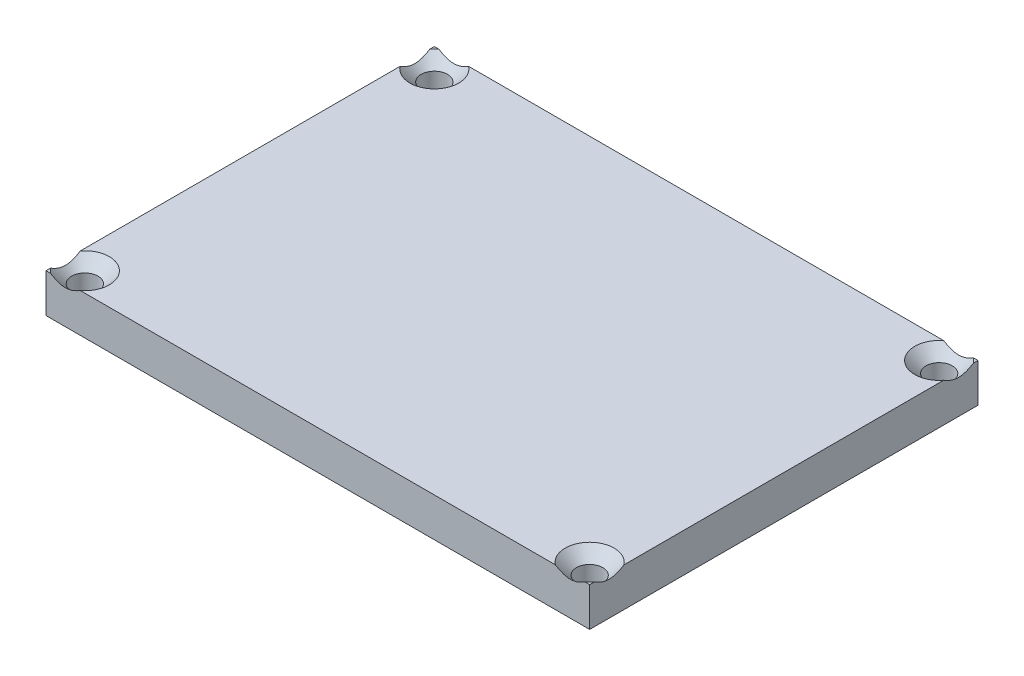
from build123d import *

# Parameters (mm, degrees)
CROQUIS1_W              = 70
CROQUIS1_H              = 50
SALIENTE_EXTRUIR1_DEPTH = 5


# Read off the part's stored shape, not the designer's step: Avellanado para tornillo con cabeza plana avellanada de M31
with BuildPart() as part:
    # Croquis1 → Saliente-Extruir1 (new body)
    with BuildSketch(Plane(origin=(0, 0, 0), x_dir=(1, 0, 0), z_dir=(0, 1, 0))):
        with Locations((-2.583892617, -6.286353468)):
            Rectangle(CROQUIS1_W, CROQUIS1_H)
    extrude(amount=SALIENTE_EXTRUIR1_DEPTH)

    # Avellanado para tornillo con cabeza  2 → Avellanado para tornillo con cabeza plana avellanada de M31 (revolve, cut)
    with BuildSketch(Plane(origin=(-35.083881152, 0, 28.786353921), x_dir=(1, 0, 0), z_dir=(0, 0, 1))):
        Polygon((3.15, 5), (0, 5), (0, 0), (1.7, 0), (1.7, 3.55), align=None)
    revolve(axis=Axis((-35.083881152, 0, 28.786353921), (0, 1, 0)), mode=Mode.SUBTRACT)

    # Avellanado para tornillo con cabeza 3 ou → Avellanado para tornillo con cabeza  3 (revolve, cut)
    with BuildSketch(Plane(origin=(29.916117476, 0, 28.786354313), x_dir=(1, 0, 0), z_dir=(0, 0, 1))):
        Polygon((3.15, 5), (0, 5), (0, 0), (1.7, 0), (1.7, 3.55), align=None)
    revolve(axis=Axis((29.916117476, 0, 28.786354313), (0, 1, 0)), mode=Mode.SUBTRACT)

    # Avellanado para tornillo con cabeza 4 ou → Avellanado para tornillo con cabeza  4 (revolve, cut)
    with BuildSketch(Plane(origin=(29.916118299, 0, -16.213646367), x_dir=(1, 0, 0), z_dir=(0, 0, 1))):
        Polygon((3.15, 5), (0, 5), (0, 0), (1.7, 0), (1.7, 3.55), align=None)
    revolve(axis=Axis((29.916118299, 0, -16.213646367), (0, 1, 0)), mode=Mode.SUBTRACT)

    # Avellanado para tornillo con cabeza 5 ou → Avellanado para tornillo con cabeza  5 (revolve, cut)
    with BuildSketch(Plane(origin=(-35.083915903, 0, -16.21364324), x_dir=(1, 0, 0), z_dir=(0, 0, 1))):
        Polygon((3.15, 5), (0, 5), (0, 0), (1.7, 0), (1.7, 3.55), align=None)
    revolve(axis=Axis((-35.083915903, 0, -16.21364324), (0, 1, 0)), mode=Mode.SUBTRACT)


solid = part.part
